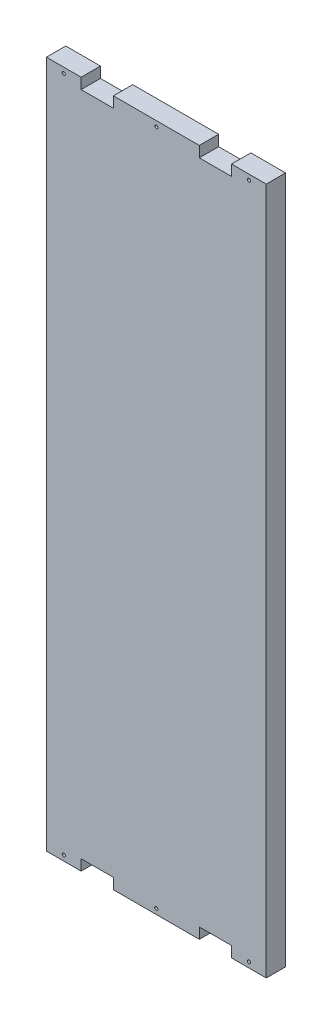
from build123d import *

# Parameters (mm, degrees)
SKETCH1_W                    = 204.6
SKETCH1_H                    = 640
BOSS_EXTRUDE1_DEPTH          = 18
SKETCH4_W                    = 30
SKETCH4_H                    = 10
CUT_EXTRUDE1_DEPTH           = 18
F_3_0_3_DIAMETER_HOLE3_D     = 3
F_3_0_3_DIAMETER_HOLE3_DEPTH = 5
F_3_0_3_DIAMETER_HOLE3_TIP   = 0.901290929
F_3_0_3_DIAMETER_HOLE5_D     = 3


with BuildPart() as part:
    # Sketch1 → Boss-Extrude1 (new body)
    with BuildSketch(Plane.XY):
        with Locations((97, 283.5)):
            Rectangle(SKETCH1_W, SKETCH1_H)
    extrude(amount=BOSS_EXTRUDE1_DEPTH)

    # Sketch4 → Cut-Extrude1 (cut)
    with BuildSketch(Plane(origin=(0, 0, 0), x_dir=(-1, 0, 0), z_dir=(0, 0, -1))):
        with Locations((-42, -31.5)):
            Rectangle(SKETCH4_W, SKETCH4_H)
        with Locations((-152, -31.5)):
            Rectangle(SKETCH4_W, SKETCH4_H)
        with Locations((-42, 598.5)):
            Rectangle(SKETCH4_W, SKETCH4_H)
        with Locations((-152, 598.5)):
            Rectangle(SKETCH4_W, SKETCH4_H)
    extrude(amount=-CUT_EXTRUDE1_DEPTH, mode=Mode.SUBTRACT)

    # Ø3.0 (3) Diameter Hole3
    with Locations(Plane(origin=(0, 0, 0), x_dir=(-1, 0, 0), z_dir=(0, 0, -1))):
        with Locations((-2.2, 190.5), (-2.2, -1.5), (-191.8, -1.5), (-191.8, 190.5), (-191.8, 478.5), (-2.2, 478.5)):
            Hole(F_3_0_3_DIAMETER_HOLE3_D / 2, depth=F_3_0_3_DIAMETER_HOLE3_DEPTH)
            with Locations((0, 0, -(F_3_0_3_DIAMETER_HOLE3_DEPTH + F_3_0_3_DIAMETER_HOLE3_TIP / 2))):  # 118° drill point
                Cone(0, F_3_0_3_DIAMETER_HOLE3_D / 2, F_3_0_3_DIAMETER_HOLE3_TIP, mode=Mode.SUBTRACT)

    # Ø3.0 (3) Diameter Hole5 (through all)
    with Locations(Plane(origin=(0, 0, 0), x_dir=(-1, 0, 0), z_dir=(0, 0, -1))):
        with Locations((238.536571684, 43.354956744), (-97, -31.5), (-183.15, -31.5), (-10.85, -31.5), (-10.85, 598.5), (-183.15, 598.5), (-97, 598.5)):
            Hole(F_3_0_3_DIAMETER_HOLE5_D / 2)


solid = part.part
